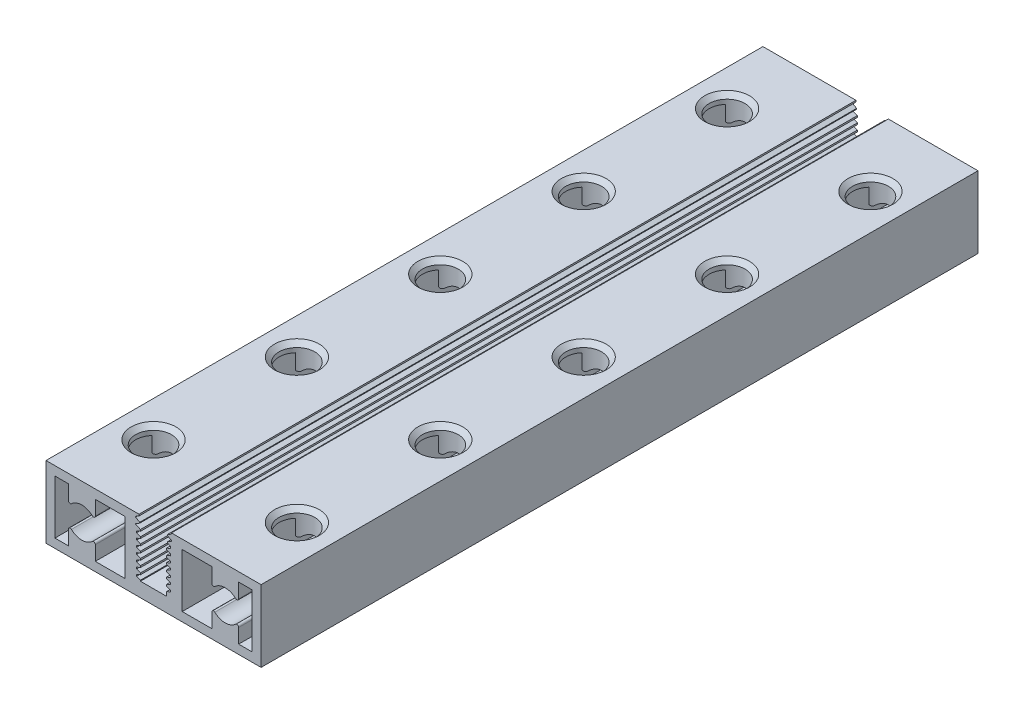
from build123d import *
from OCP.BRepFilletAPI import BRepFilletAPI_MakeChamfer

# Parameters (mm, degrees)
SKETCH1_W                    = 24
SKETCH1_H                    = 80
BOSS_EXTRUDE1_DEPTH          = 8
CUT_EXTRUDE1_DEPTH           = 82.289605732
CUT_EXTRUDE2_DEPTH           = 82.289605732
CUT_EXTRUDE3_DEPTH           = 82.289605732
F_4_0_4_DIAMETER_HOLE1_D     = 4
F_4_0_4_DIAMETER_HOLE1_DEPTH = 10.814359354
CHAMFER1_SIZE                = 0.236832298
CHAMFER1_SIZE2               = 0.253557323
CHAMFER2_SIZE                = 0.086213795
CHAMFER2_SIZE2               = 0.080527003
CHAMFER3_SIZE                = 0.5


with BuildPart() as part:
    # Sketch1 → Boss-Extrude1 (new body)
    with BuildSketch(Plane(origin=(0, 8, 0), x_dir=(1, 0, 0), z_dir=(0, 1, 0))):
        with Locations((0, -56)):
            Rectangle(SKETCH1_W, SKETCH1_H)
    extrude(amount=-BOSS_EXTRUDE1_DEPTH)

    # Sketch2 → Cut-Extrude1 (cut, through all)
    with BuildSketch(Plane(origin=(0, 0, 16), x_dir=(-1, 0, 0), z_dir=(0, 0, -1))):
        Polygon((1.62, 8), (-2, 8), (-2, 7.88), (-1.468445554, 7.573106898), (-2.074663337, 7.223106898), (-1.468445554, 6.873106898), (-2.087849868, 6.515493651), (-1.240412917, 6.173106898), (-2.106693316, 5.823106898), (-1.240412917, 5.473106898), (-2.106693316, 5.123106898), (-1.240412917, 4.773106898), (-2.106693316, 4.423106898), (-1.240412917, 4.073106898), (-2.106693316, 3.723106898), (-1.240412917, 3.373106898), (-2.106693316, 3.023106898), (-1.240412917, 2.673106898), (-2.106693316, 2.323106898), (-1.46, 2.061825838), (-1.46, 1.6), (1.46, 1.6), (1.46, 1.70121894), (2.106693316, 1.9625), (1.240412917, 2.3125), (2.106693316, 2.6625), (1.240412917, 3.0125), (2.106693316, 3.3625), (1.240412917, 3.7125), (2.106693316, 4.0625), (1.240412917, 4.4125), (2.106693316, 4.7625), (1.240412917, 5.1125), (2.106693316, 5.4625), (1.240412917, 5.8125), (2.106693316, 6.1625), (1.240412917, 6.5125), (2.087849868, 6.854886753), (1.468445554, 7.2125), (2.074663337, 7.5625), (1.62, 7.825), align=None)
    extrude(amount=-CUT_EXTRUDE1_DEPTH, mode=Mode.SUBTRACT)

    # Sketch3 → Cut-Extrude2 (cut, through all)
    with BuildSketch(Plane.XY.offset(96)):
        with BuildLine():
            Line((9.5, 1), (11, 1))
            Line((11, 1), (11, 7))
            Line((11, 7), (9.5, 7))
            Line((9.5, 7), (9.5, 5.385640646))
            ThreePointArc((9.5, 5.385640646), (9.379471941, 5.202108059), (9.163157895, 5.239783736))
            ThreePointArc((9.163157895, 5.239783736), (8, 5.7), (6.836842105, 5.239783736))
            ThreePointArc((6.836842105, 5.239783736), (6.620528059, 5.202108059), (6.5, 5.385640646))
            Line((6.5, 5.385640646), (6.5, 7))
            Line((6.5, 7), (3.2, 7))
            Line((3.2, 7), (3.2, 1))
            Line((3.2, 1), (6.5, 1))
            Line((6.5, 1), (6.5, 2.614359354))
            ThreePointArc((6.5, 2.614359354), (6.620528059, 2.797891941), (6.836842105, 2.760216264))
            ThreePointArc((6.836842105, 2.760216264), (8, 2.3), (9.163157895, 2.760216264))
            ThreePointArc((9.163157895, 2.760216264), (9.379471941, 2.797891941), (9.5, 2.614359354))
            Line((9.5, 2.614359354), (9.5, 1))
        make_face()
    extrude(amount=-CUT_EXTRUDE2_DEPTH, mode=Mode.SUBTRACT)

    # Sketch4 → Cut-Extrude3 (cut, through all)
    with BuildSketch(Plane(origin=(0, 0, 16), x_dir=(-1, 0, 0), z_dir=(0, 0, -1))):
        with BuildLine():
            Line((11, 7), (9.5, 7))
            Line((9.5, 7), (9.5, 5.385640646))
            ThreePointArc((9.5, 5.385640646), (9.379471941, 5.202108059), (9.163157895, 5.239783736))
            ThreePointArc((9.163157895, 5.239783736), (8, 5.7), (6.836842105, 5.239783736))
            ThreePointArc((6.836842105, 5.239783736), (6.620528059, 5.202108059), (6.5, 5.385640646))
            Line((6.5, 5.385640646), (6.5, 7))
            Line((6.5, 7), (3.2, 7))
            Line((3.2, 7), (3.2, 1))
            Line((3.2, 1), (6.5, 1))
            Line((6.5, 1), (6.5, 2.614359354))
            ThreePointArc((6.5, 2.614359354), (6.620528059, 2.797891941), (6.836842105, 2.760216264))
            ThreePointArc((6.836842105, 2.760216264), (8, 2.3), (9.163157895, 2.760216264))
            ThreePointArc((9.163157895, 2.760216264), (9.379471941, 2.797891941), (9.5, 2.614359354))
            Line((9.5, 2.614359354), (9.5, 1))
            Line((9.5, 1), (11, 1))
            Line((11, 1), (11, 7))
        make_face()
    extrude(amount=-CUT_EXTRUDE3_DEPTH, mode=Mode.SUBTRACT)

    # Ø4.0 (4) Diameter Hole1
    with Locations(Plane(origin=(0, 8, 0), x_dir=(1, 0, 0), z_dir=(0, 1, 0))):
        with Locations((-8, -88), (-8, -72), (-8, -56), (-8, -40), (-8, -24), (8, -40), (8, -56), (8, -24), (8, -72), (8, -88)):
            Hole(F_4_0_4_DIAMETER_HOLE1_D / 2, depth=F_4_0_4_DIAMETER_HOLE1_DEPTH)

    # Chamfer1: one chamfer whose edges measure the first distance from different faces: ONE call of the kernel's chamfer builder (chamfer() names one face for all edges)
    chamfer1_edges_1 = [part.edges().sort_by_distance(p)[0] for p in [
        (2.106693316, 2.323106898, 56),
        (2.106693316, 5.123106898, 56),
        (1.240412917, 2.673106898, 56),
        (-1.240412917, 4.4125, 56),
        (-2.106693316, 4.7625, 56),
        (1.240412917, 4.773106898, 56),
        (-1.240412917, 5.1125, 56),
        (-2.106693316, 5.4625, 56),
        (1.240412917, 5.473106898, 56),
        (-2.106693316, 4.0625, 56),
        (-1.240412917, 3.7125, 56),
        (2.106693316, 4.423106898, 56),
        (2.106693316, 5.823106898, 56),
        (1.240412917, 4.073106898, 56),
        (-1.240412917, 5.8125, 56),
        (-2.106693316, 6.1625, 56),
        (1.240412917, 6.173106898, 56),
        (-2.106693316, 1.9625, 56),
        (-2.106693316, 3.3625, 56),
        (-1.240412917, 3.0125, 56),
        (2.106693316, 3.723106898, 56),
        (1.240412917, 3.373106898, 56),
        (-1.240412917, 6.5125, 56),
        (-2.106693316, 2.6625, 56),
        (-1.240412917, 2.3125, 56),
        (2.106693316, 3.023106898, 56),
    ]]
    chamfer1_edges_2 = [part.edges().sort_by_distance(p)[0] for p in [
        (2.087849868, 6.515493651, 56),
    ]]
    chamfer1_side_2 = [part.faces().sort_by_distance(p)[0] for p in [
        (1.664131392, 6.344300274, 56),
    ]]
    chamfer1 = BRepFilletAPI_MakeChamfer(part.part.solid().wrapped)
    for e in chamfer1_edges_1:
        chamfer1.Add(CHAMFER1_SIZE, e.wrapped)
    for e in chamfer1_edges_2:
        chamfer1.Add(CHAMFER1_SIZE, CHAMFER1_SIZE2, e.wrapped, chamfer1_side_2[0].wrapped)  # the first distance lies on this face
    add(Compound.cast(chamfer1.Shape()), mode=Mode.REPLACE)

    # Chamfer2: one chamfer whose edges measure the first distance from different faces: ONE call of the kernel's chamfer builder (chamfer() names one face for all edges)
    chamfer2_edges_1 = [part.edges().sort_by_distance(p)[0] for p in [
        (1.468445554, 7.573106898, 56),
        (-1.468445554, 7.2125, 56),
        (-2.074663337, 7.5625, 56),
        (1.468445554, 6.873106898, 56),
        (2.074663337, 7.223106898, 56),
    ]]
    chamfer2_edges_2 = [part.edges().sort_by_distance(p)[0] for p in [
        (-2.087849868, 6.854886753, 56),
    ]]
    chamfer2_side_2 = [part.faces().sort_by_distance(p)[0] for p in [
        (-1.778147711, 7.033693376, 56),
    ]]
    chamfer2 = BRepFilletAPI_MakeChamfer(part.part.solid().wrapped)
    for e in chamfer2_edges_1:
        chamfer2.Add(CHAMFER2_SIZE, e.wrapped)
    for e in chamfer2_edges_2:
        chamfer2.Add(CHAMFER2_SIZE, CHAMFER2_SIZE2, e.wrapped, chamfer2_side_2[0].wrapped)  # the first distance lies on this face
    add(Compound.cast(chamfer2.Shape()), mode=Mode.REPLACE)

    # Chamfer3
    chamfer3_edges = [part.edges().sort_by_distance(p)[0] for p in [
        (-6, 0, 56),
        (-6, 8, 40),
        (10, 8, 56),
        (-6, 0, 24),
        (-6, 0, 88),
        (10, 8, 24),
        (10, 8, 88),
        (-6, 8, 72),
        (-6, 0, 40),
        (-6, 0, 72),
        (10, 8, 40),
        (10, 8, 72),
        (-6, 8, 24),
        (-6, 8, 56),
        (-6, 8, 88),
        (10, 0, 24),
        (10, 0, 40),
        (10, 0, 56),
        (10, 0, 72),
        (10, 0, 88),
    ]]
    chamfer(chamfer3_edges, length=CHAMFER3_SIZE)


solid = part.part
